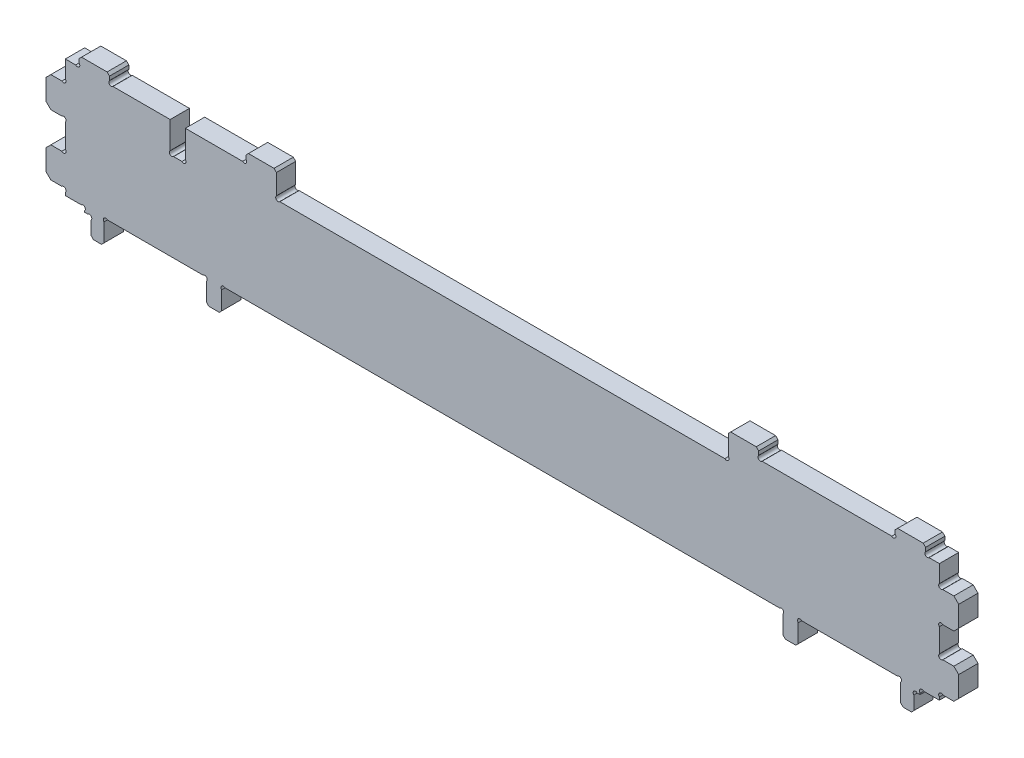
from build123d import *

# Parameters (mm, degrees)
BOSS_EXTRUDE1_DEPTH = 6.35
SKETCH2_W           = 148.521999998
SKETCH2_H           = 2.032
CUT_EXTRUDE1_DEPTH  = 169.008101824
SKETCH3_R           = 0.79375
CUT_EXTRUDE2_DEPTH  = 169.008101824
CHAMFER1_SIZE       = 0.79375
CHAMFER2_SIZE       = 1.5875


with BuildPart() as part:
    # Sketch1 → Boss-Extrude1 (new body)
    with BuildSketch(Plane.XY):
        with BuildLine():
            Line((134.621545702, -67.612541882), (134.621545702, -60.810273898))
            ThreePointArc((134.621545702, -60.810273898), (134.621545702, -59.687741882), (133.499013687, -59.687741882))
            Line((133.499013687, -59.687741882), (102.049077718, -59.687741882))
            ThreePointArc((102.049077718, -59.687741882), (100.926545702, -59.687741882), (100.926545702, -60.810273898))
            Line((100.926545702, -60.810273898), (100.926545702, -67.612541882))
            Line((100.926545702, -67.612541882), (95.926545702, -67.612541882))
            Line((95.926545702, -67.612541882), (95.926545702, -60.810273898))
            ThreePointArc((95.926545702, -60.810273898), (95.926545702, -59.687741882), (94.804013687, -59.687741882))
            Line((94.804013687, -59.687741882), (-87.460922281, -59.687741882))
            ThreePointArc((-87.460922281, -59.687741882), (-88.583454296, -59.687741882), (-88.583454296, -60.810273898))
            Line((-88.583454296, -60.810273898), (-88.583454296, -67.612541882))
            Line((-88.583454296, -67.612541882), (-93.583454296, -67.612541882))
            Line((-93.583454296, -67.612541882), (-93.583454296, -60.810273898))
            ThreePointArc((-93.583454296, -60.810273898), (-93.583454296, -59.687741882), (-94.705986312, -59.687741882))
            Line((-94.705986312, -59.687741882), (-126.155922281, -59.687741882))
            ThreePointArc((-126.155922281, -59.687741882), (-127.278454296, -59.687741882), (-127.278454296, -60.810273898))
            Line((-127.278454296, -60.810273898), (-127.278454296, -67.612541882))
            Line((-127.278454296, -67.612541882), (-131.507694323, -67.612541882))
            Line((-131.507694323, -67.612541882), (-131.507694323, -62.385073898))
            ThreePointArc((-131.507694323, -62.385073898), (-131.507694323, -61.262541882), (-132.630226338, -61.262541882))
            Line((-132.630226338, -61.262541882), (-133.628454296, -61.262541882))
            Line((-133.628454296, -61.262541882), (-133.628454296, -60.810273898))
            ThreePointArc((-133.628454296, -60.810273898), (-133.628454296, -59.687741882), (-134.750986312, -59.687741882))
            Line((-134.750986312, -59.687741882), (-139.978454296, -59.687741882))
            Line((-139.978454296, -59.687741882), (-139.978454296, -58.735073898))
            ThreePointArc((-139.978454296, -58.735073898), (-139.978454296, -57.612541882), (-141.100986312, -57.612541882))
            Line((-141.100986312, -57.612541882), (-146.328454296, -57.612541882))
            Line((-146.328454296, -57.612541882), (-146.328454296, -47.612541882))
            Line((-146.328454296, -47.612541882), (-141.100986312, -47.612541882))
            ThreePointArc((-141.100986312, -47.612541882), (-139.978454296, -47.612541882), (-139.978454296, -46.490009867))
            Line((-139.978454296, -46.490009867), (-139.978454296, -38.735073898))
            ThreePointArc((-139.978454296, -38.735073898), (-139.978454296, -37.612541882), (-141.100986312, -37.612541882))
            Line((-141.100986312, -37.612541882), (-146.328454296, -37.612541882))
            Line((-146.328454296, -37.612541882), (-146.328454296, -27.612541882))
            Line((-146.328454296, -27.612541882), (-141.100986312, -27.612541882))
            ThreePointArc((-141.100986312, -27.612541882), (-139.978454296, -27.612541882), (-139.978454296, -26.490009867))
            Line((-139.978454296, -26.490009867), (-139.978454296, -20.787541882))
            Line((-139.978454296, -20.787541882), (-136.575986312, -20.787541882))
            ThreePointArc((-136.575986312, -20.787541882), (-135.453454296, -20.787541882), (-135.453454296, -19.665009867))
            Line((-135.453454296, -19.665009867), (-135.453454296, -17.612541882))
            Line((-135.453454296, -17.612541882), (-125.453454296, -17.612541882))
            Line((-125.453454296, -17.612541882), (-125.453454296, -19.665009867))
            ThreePointArc((-125.453454296, -19.665009867), (-125.453454296, -20.787541882), (-124.330922281, -20.787541882))
            Line((-124.330922281, -20.787541882), (-105.521454296, -20.787541882))
            Line((-105.521454296, -20.787541882), (-105.521454296, -29.665009867))
            ThreePointArc((-105.521454296, -29.665009867), (-105.521454296, -30.787541882), (-104.398922281, -30.787541882))
            Line((-104.398922281, -30.787541882), (-101.643986312, -30.787541882))
            ThreePointArc((-101.643986312, -30.787541882), (-100.521454296, -30.787541882), (-100.521454296, -29.665009867))
            Line((-100.521454296, -29.665009867), (-100.521454296, -20.787541882))
            Line((-100.521454296, -20.787541882), (-81.711986312, -20.787541882))
            ThreePointArc((-81.711986312, -20.787541882), (-80.589454296, -20.787541882), (-80.589454296, -19.665009867))
            Line((-80.589454296, -19.665009867), (-80.589454296, -17.612541882))
            Line((-80.589454296, -17.612541882), (-70.589454296, -17.612541882))
            Line((-70.589454296, -17.612541882), (-70.589454296, -24.127741882))
            Line((-70.589454296, -24.127741882), (77.932545702, -24.127741882))
            Line((77.932545702, -24.127741882), (77.932545702, -17.612541882))
            Line((77.932545702, -17.612541882), (87.932545702, -17.612541882))
            Line((87.932545702, -17.612541882), (87.932545702, -19.665009867))
            ThreePointArc((87.932545702, -19.665009867), (87.932545702, -20.787541882), (89.055077718, -20.787541882))
            Line((89.055077718, -20.787541882), (131.674013687, -20.787541882))
            ThreePointArc((131.674013687, -20.787541882), (132.796545702, -20.787541882), (132.796545702, -19.665009867))
            Line((132.796545702, -19.665009867), (132.796545702, -17.612541882))
            Line((132.796545702, -17.612541882), (142.796545702, -17.612541882))
            Line((142.796545702, -17.612541882), (142.796545702, -19.665009867))
            ThreePointArc((142.796545702, -19.665009867), (142.796545702, -20.787541882), (143.919077718, -20.787541882))
            Line((143.919077718, -20.787541882), (147.321545702, -20.787541882))
            Line((147.321545702, -20.787541882), (147.321545702, -26.490009867))
            ThreePointArc((147.321545702, -26.490009867), (147.321545702, -27.612541882), (148.444077718, -27.612541882))
            Line((148.444077718, -27.612541882), (153.671545702, -27.612541882))
            Line((153.671545702, -27.612541882), (153.671545702, -37.612541883))
            Line((153.671545702, -37.612541883), (148.444077718, -37.612541883))
            ThreePointArc((148.444077718, -37.612541883), (147.321545702, -37.612541883), (147.321545702, -38.735073898))
            Line((147.321545702, -38.735073898), (147.321545702, -46.490009867))
            ThreePointArc((147.321545702, -46.490009867), (147.321545702, -47.612541883), (148.444077718, -47.612541882))
            Line((148.444077718, -47.612541882), (153.671545702, -47.612541882))
            Line((153.671545702, -47.612541882), (153.671545702, -57.612541882))
            Line((153.671545702, -57.612541882), (148.444077718, -57.612541882))
            ThreePointArc((148.444077718, -57.612541882), (147.321545702, -57.612541882), (147.321545702, -58.735073898))
            Line((147.321545702, -58.735073898), (147.321545702, -59.687741882))
            Line((147.321545702, -59.687741882), (142.094077718, -59.687741882))
            ThreePointArc((142.094077718, -59.687741882), (140.971545702, -59.687741882), (140.971545702, -60.810273898))
            Line((140.971545702, -60.810273898), (140.971545702, -61.262541882))
            Line((140.971545702, -61.262541882), (140.071500685, -61.262541882))
            ThreePointArc((140.071500685, -61.262541882), (138.948968669, -61.262541882), (138.948968669, -62.385073898))
            Line((138.948968669, -62.385073898), (138.948968669, -67.612541882))
            Line((138.948968669, -67.612541882), (134.621545702, -67.612541882))
        make_face()
    extrude(amount=BOSS_EXTRUDE1_DEPTH)

    # Sketch2 → Cut-Extrude1 (cut, through all)
    with BuildSketch(Plane.XY.offset(6.35)):
        with Locations((3.671545703, -25.143741882)):
            Rectangle(SKETCH2_W, SKETCH2_H)
    extrude(amount=-CUT_EXTRUDE1_DEPTH, mode=Mode.SUBTRACT)

    # Sketch3 → Cut-Extrude2 (cut, through all)
    with BuildSketch(Plane.XY.offset(6.35)):
        with Locations((-70.028188289, -25.598475875)):
            Circle(SKETCH3_R)
        with Locations((77.371279695, -25.598475875)):
            Circle(SKETCH3_R)
    extrude(amount=-CUT_EXTRUDE2_DEPTH, mode=Mode.SUBTRACT)

    # Chamfer1
    chamfer1_edges = [part.edges().sort_by_distance(p)[0] for p in [
        (-131.507694323, -67.612541882, 3.175),
        (-93.583454296, -67.612541882, 3.175),
        (-127.278454296, -67.612541882, 3.175),
        (-88.583454296, -67.612541882, 3.175),
        (100.926545702, -67.612541882, 3.175),
        (95.926545702, -67.612541882, 3.175),
        (134.621545702, -67.612541882, 3.175),
        (138.948968669, -67.612541882, 3.175),
        (132.796545702, -17.612541882, 3.175),
        (142.796545702, -17.612541882, 3.175),
        (87.932545702, -17.612541882, 3.175),
        (77.932545702, -17.612541882, 3.175),
        (-70.589454296, -17.612541882, 3.175),
        (-80.589454296, -17.612541882, 3.175),
        (-125.453454296, -17.612541882, 3.175),
        (-135.453454296, -17.612541882, 3.175),
    ]]
    chamfer(chamfer1_edges, length=CHAMFER1_SIZE)

    # Chamfer2
    chamfer2_edges = [part.edges().sort_by_distance(p)[0] for p in [
        (153.671545702, -57.612541882, 3.175),
        (153.671545702, -47.612541882, 3.175),
        (153.671545702, -37.612541883, 3.175),
        (153.671545702, -27.612541882, 3.175),
        (-146.328454296, -57.612541882, 3.175),
        (-146.328454296, -47.612541882, 3.175),
        (-146.328454296, -37.612541882, 3.175),
        (-146.328454296, -27.612541882, 3.175),
    ]]
    chamfer(chamfer2_edges, length=CHAMFER2_SIZE)


solid = part.part
